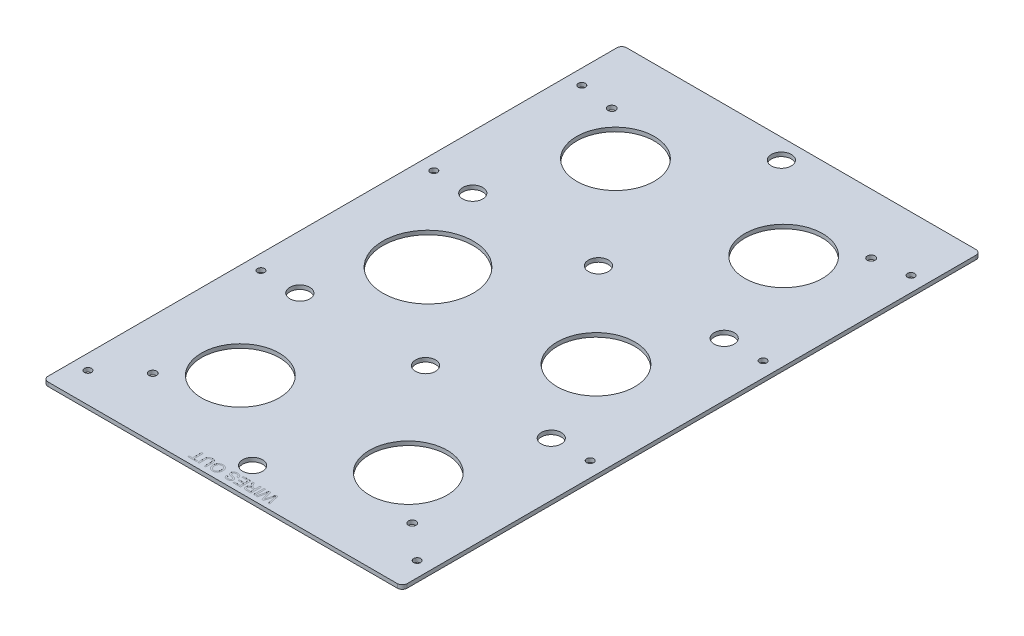
from build123d import *

# Parameters (mm, degrees)
SKETCH1_R           = 24.727
SKETCH1_R_2         = 28.76928198
SKETCH1_R_3         = 6.35
SKETCH1_R_4         = 2.45745
SKETCH1_R_5         = 2.2479
BOSS_EXTRUDE1_DEPTH = 2.54
SKETCH2_W           = 0.941716851
SKETCH2_H           = 6.677628581
CUT_EXTRUDE2_DEPTH  = 0.0254


with BuildPart() as part:
    # Sketch1 → Boss-Extrude1 (new body)
    with BuildSketch(Plane(origin=(0, 0, 0), x_dir=(1, 0, 0), z_dir=(0, 1, 0))):
        with BuildLine():
            Line((-56.121310553, 212.595268584), (166.128689447, 212.595268584))
            ThreePointArc((166.128689447, 212.595268584), (168.373753477, 211.665332614), (169.303689447, 209.420268584))
            Line((169.303689447, 209.420268584), (169.303689447, -152.529731416))
            ThreePointArc((169.303689447, -152.529731416), (168.373753477, -154.774795446), (166.128689447, -155.704731416))
            Line((166.128689447, -155.704731416), (-56.121310553, -155.704731416))
            ThreePointArc((-56.121310553, -155.704731416), (-58.366374583, -154.774795446), (-59.296310553, -152.529731416))
            Line((-59.296310553, -152.529731416), (-59.296310553, 209.420268584))
            ThreePointArc((-59.296310553, 209.420268584), (-58.366374583, 211.665332614), (-56.121310553, 212.595268584))
        make_face()
        with Locations((108.521489447, -91.0633131)):
            Circle(SKETCH1_R, mode=Mode.SUBTRACT)
        with Locations((108.521489447, 28.380977742)):
            Circle(SKETCH1_R, mode=Mode.SUBTRACT)
        with Locations((1.485889447, -90.934731416)):
            Circle(SKETCH1_R, mode=Mode.SUBTRACT)
        with Locations((1.485889447, 147.825268584)):
            Circle(SKETCH1_R, mode=Mode.SUBTRACT)
        with Locations((108.521489447, 147.825268584)):
            Circle(SKETCH1_R, mode=Mode.SUBTRACT)
        with Locations((1.485889447, 28.509559426)):
            Circle(SKETCH1_R_2, mode=Mode.SUBTRACT)
        with Locations((55.003689447, -136.654731416)):
            Circle(SKETCH1_R_3, mode=Mode.SUBTRACT)
        with Locations((135.013689447, -26.583831416)):
            Circle(SKETCH1_R_3, mode=Mode.SUBTRACT)
        with Locations((55.003689447, -26.588064749)):
            Circle(SKETCH1_R_3, mode=Mode.SUBTRACT)
        with Locations((-25.006310553, -26.583831416)):
            Circle(SKETCH1_R_3, mode=Mode.SUBTRACT)
        with Locations((135.013689447, 83.474368584)):
            Circle(SKETCH1_R_3, mode=Mode.SUBTRACT)
        with Locations((55.003689447, 83.478601917)):
            Circle(SKETCH1_R_3, mode=Mode.SUBTRACT)
        with Locations((-25.006310553, 83.474368584)):
            Circle(SKETCH1_R_3, mode=Mode.SUBTRACT)
        with Locations((55.003689447, 199.895268584)):
            Circle(SKETCH1_R_3, mode=Mode.SUBTRACT)
        with Locations((137.553689447, 174.495268584)):
            Circle(SKETCH1_R_4, mode=Mode.SUBTRACT)
        with Locations((-27.546310553, 174.495268584)):
            Circle(SKETCH1_R_4, mode=Mode.SUBTRACT)
        with Locations((-27.546310553, -117.604731416)):
            Circle(SKETCH1_R_4, mode=Mode.SUBTRACT)
        with Locations((137.553689447, -117.604731416)):
            Circle(SKETCH1_R_4, mode=Mode.SUBTRACT)
        with Locations((-49.771310553, 177.670268584)):
            Circle(SKETCH1_R_5, mode=Mode.SUBTRACT)
        with Locations((-49.771310553, 83.478601917)):
            Circle(SKETCH1_R_5, mode=Mode.SUBTRACT)
        with Locations((159.778689447, 177.670268584)):
            Circle(SKETCH1_R_5, mode=Mode.SUBTRACT)
        with Locations((159.778689447, 83.478601917)):
            Circle(SKETCH1_R_5, mode=Mode.SUBTRACT)
        with Locations((159.778689447, -26.588064749)):
            Circle(SKETCH1_R_5, mode=Mode.SUBTRACT)
        with Locations((-49.771310553, -26.588064749)):
            Circle(SKETCH1_R_5, mode=Mode.SUBTRACT)
        with Locations((-49.771310553, -136.654731416)):
            Circle(SKETCH1_R_5, mode=Mode.SUBTRACT)
        with Locations((159.778689447, -136.654731416)):
            Circle(SKETCH1_R_5, mode=Mode.SUBTRACT)
    extrude(amount=BOSS_EXTRUDE1_DEPTH)

    # Sketch2 → Cut-Extrude2 (cut)
    # profile 1 of 8: a face of its own
    with BuildSketch(Plane(origin=(0, 2.54, 0), x_dir=(1, 0, 0), z_dir=(0, 1, 0))):
        with BuildLine():
            Line((80.029279661, -145.704731416), (81.7107258, -152.382359997))
            Line((81.7107258, -152.382359997), (80.738242631, -152.382359997))
            Line((80.738242631, -152.382359997), (79.747032138, -147.990802579))
            add(Edge.make_bspline(
                [(79.747032138, -147.990802579), (79.695661446, -147.764312224), (79.593444513, -147.313643795), (79.492338116, -146.862724924), (79.442044295, -146.638422271)],
                knots=[0, 0, 0, 0, 1.00513078, 2, 2, 2, 2], degree=3))
            add(Edge.make_bspline(
                [(79.442044295, -146.638422271), (79.418231748, -146.719075954), (79.373278, -146.87133541), (79.312509244, -147.08717786), (79.25731493, -147.27555915), (79.210292208, -147.437357484), (79.172218091, -147.572800178), (79.139345331, -147.680222921), (79.116939668, -147.761729399), (79.103662032, -147.806664191), (79.098264137, -147.824931997)],
                knots=[0, 0, 0, 0, 1.633809233, 3.084334118, 4.356383392, 5.447555203, 6.357852567, 7.089694452, 7.629924063, 8, 8, 8, 8], degree=3))
            Line((79.098264137, -147.824931997), (77.779325479, -152.382359997))
            Line((77.779325479, -152.382359997), (76.646322393, -152.382359997))
            Line((76.646322393, -152.382359997), (75.692566548, -149.036857377))
            add(Edge.make_bspline(
                [(75.692566548, -149.036857377), (75.639932506, -148.830185346), (75.536149567, -148.422672829), (75.398257182, -147.81566784), (75.270986917, -147.223388915), (75.197676855, -146.831660892), (75.161513153, -146.638422271)],
                knots=[0, 0, 0, 0, 1.04154457, 2.053700482, 3.039894486, 4, 4, 4, 4], degree=3))
            add(Edge.make_bspline(
                [(75.161513153, -146.638422271), (75.139132616, -146.736944292), (75.091854028, -146.94507076), (75.019147923, -147.273539991), (74.936629564, -147.63395597), (74.880486071, -147.885100536), (74.851174645, -148.016218233)],
                knots=[0, 0, 0, 0, 0.858436457, 1.813435672, 2.858437265, 4, 4, 4, 4], degree=3))
            Line((74.851174645, -148.016218233), (73.865314817, -152.382359997))
            Line((73.865314817, -152.382359997), (72.892831648, -152.382359997))
            Line((72.892831648, -152.382359997), (74.575615453, -145.704731416))
            Line((74.575615453, -145.704731416), (75.610968923, -145.704731416))
            Line((75.610968923, -145.704731416), (77.006154542, -150.807927136))
            add(Edge.make_bspline(
                [(77.006154542, -150.807927136), (77.020164215, -150.857815617), (77.046777378, -150.952585154), (77.081661001, -151.087824496), (77.116254037, -151.206761932), (77.143769386, -151.310934535), (77.167581617, -151.399292569), (77.188668366, -151.471577335), (77.202230796, -151.529203562), (77.212038516, -151.561956596), (77.216168101, -151.57574741)],
                knots=[0, 0, 0, 0, 1.562239628, 2.967673567, 4.210417925, 5.296319877, 6.215971374, 6.969386481, 7.566055473, 8, 8, 8, 8], degree=3))
            add(Edge.make_bspline(
                [(77.216168101, -151.57574741), (77.240993719, -151.488311611), (77.288018835, -151.322689209), (77.356503208, -151.089823335), (77.415382597, -150.885483445), (77.452024197, -150.759319766), (77.468986972, -150.700913858)],
                knots=[0, 0, 0, 0, 1.197732026, 2.268764715, 3.198546125, 4, 4, 4, 4], degree=3))
            Line((77.468986972, -150.700913858), (78.915003898, -145.704731416))
            Line((78.915003898, -145.704731416), (80.029279661, -145.704731416))
        make_face()
    # profile 2 of 8: a face of its own
    with BuildSketch(Plane(origin=(0, 2.54, 0), x_dir=(1, 0, 0), z_dir=(0, 1, 0))):
        with Locations((71.737088239, -149.043545707)):
            Rectangle(SKETCH2_W, SKETCH2_H)
    # profile 3 of 8: a face of its own
    with BuildSketch(Plane(origin=(0, 2.54, 0), x_dir=(1, 0, 0), z_dir=(0, 1, 0))):
        with BuildLine():
            Line((69.725238603, -145.704731416), (69.725238603, -152.382359997))
            Line((69.725238603, -152.382359997), (66.827854087, -152.382359997))
            add(Edge.make_bspline(
                [(66.827854087, -152.382359997), (66.759629228, -152.381827962), (66.627588, -152.380798272), (66.436106253, -152.373440351), (66.25779954, -152.357808443), (66.091544097, -152.340349513), (65.937624411, -152.314571062), (65.795967128, -152.28432829), (65.667115536, -152.248584849), (65.550089215, -152.20633462), (65.441505485, -152.158550478), (65.340885212, -152.099559989), (65.243907957, -152.035030329), (65.154439449, -151.958586204), (65.068450058, -151.876455256), (64.989539904, -151.78452804), (64.915373648, -151.685105409), (64.825197278, -151.541131601), (64.730487537, -151.348144969), (64.648912432, -151.102957418), (64.597041436, -150.846216607), (64.591442148, -150.670841687), (64.588601234, -150.581861585)],
                knots=[0, 0, 0, 0, 1.242075696, 2.40389213, 3.487198984, 4.500157661, 5.446319301, 6.326791195, 7.136300648, 7.878370406, 8.590488565, 9.292260633, 9.999224673, 10.708050372, 11.431369221, 12.162165018, 12.910600795, 13.687589445, 15.252257874, 16.810406251, 18.381693487, 20, 20, 20, 20], degree=3))
            add(Edge.make_bspline(
                [(64.588601234, -150.581861585), (64.589907939, -150.524740088), (64.592488773, -150.411921213), (64.612257927, -150.246047086), (64.648029381, -150.087561728), (64.693896712, -149.935073876), (64.756684454, -149.790755988), (64.829388085, -149.651615869), (64.919584598, -149.521641487), (65.020293841, -149.396488972), (65.13740046, -149.281806219), (65.267662733, -149.175811763), (65.41499687, -149.084850699), (65.574570578, -149.000318383), (65.750496328, -148.930895346), (65.940120993, -148.869766111), (66.14491216, -148.822633746), (66.286855968, -148.798892657), (66.359670993, -148.786713838)],
                knots=[0, 0, 0, 0, 0.982645791, 1.940792824, 2.867691729, 3.775150443, 4.675643875, 5.571354211, 6.471357401, 7.392684514, 8.331098131, 9.285922955, 10.275520706, 11.304845665, 12.388884831, 13.524255008, 14.729980297, 16, 16, 16, 16], degree=3))
            add(Edge.make_bspline(
                [(66.359670993, -148.786713838), (66.305740634, -148.75983205), (66.203466532, -148.708853145), (66.064293374, -148.624504804), (65.942371498, -148.545098059), (65.873114839, -148.485554196), (65.840656592, -148.457648007)],
                knots=[0, 0, 0, 0, 1.172551213, 2.223638478, 3.167479604, 4, 4, 4, 4], degree=3))
            add(Edge.make_bspline(
                [(65.840656592, -148.457648007), (65.777468442, -148.395895573), (65.64787995, -148.2692515), (65.471039527, -148.051539052), (65.296058038, -147.81211767), (65.191002805, -147.6376469), (65.137044286, -147.548035139)],
                knots=[0, 0, 0, 0, 0.918170575, 1.883016652, 2.912673989, 4, 4, 4, 4], degree=3))
            Line((65.137044286, -147.548035139), (64.041495847, -145.704731416))
            Line((64.041495847, -145.704731416), (65.120992294, -145.704731416))
            Line((65.120992294, -145.704731416), (65.953020535, -147.114631361))
            add(Edge.make_bspline(
                [(65.953020535, -147.114631361), (65.982937923, -147.164098167), (66.040912909, -147.259956715), (66.12462569, -147.399973664), (66.206813768, -147.528808538), (66.282671411, -147.650471976), (66.357009397, -147.761755466), (66.423648427, -147.866870579), (66.490571396, -147.959862494), (66.567413815, -148.071581699), (66.661257567, -148.192370364), (66.770766589, -148.316455456), (66.871452849, -148.419242035), (66.998685638, -148.517314097), (67.156892938, -148.607108645), (67.290284254, -148.649704776), (67.354894484, -148.670336898)],
                knots=[0, 0, 0, 0, 1.130591283, 2.190900266, 3.190104209, 4.119071823, 4.994606968, 5.807262858, 6.55236009, 7.234593472, 8.459046683, 9.540234366, 10.471327768, 11.266723835, 12.676093724, 14, 14, 14, 14], degree=3))
            add(Edge.make_bspline(
                [(67.354894484, -148.670336898), (67.382037121, -148.675231638), (67.444004575, -148.686406476), (67.549225158, -148.69370478), (67.676712802, -148.701450954), (67.769105271, -148.701225256), (67.819064579, -148.701103215)],
                knots=[0, 0, 0, 0, 0.709978628, 1.620902492, 2.713552433, 4, 4, 4, 4], degree=3))
            Line((67.819064579, -148.701103215), (68.783521752, -148.701103215))
            Line((68.783521752, -148.701103215), (68.783521752, -145.704731416))
            Line((68.783521752, -145.704731416), (69.725238603, -145.704731416))
        make_face()
        with BuildLine():
            Line((68.783521752, -149.471598821), (66.995062335, -149.471598821))
            add(Edge.make_bspline(
                [(66.995062335, -149.471598821), (66.905378152, -149.472989815), (66.737721983, -149.47559015), (66.503340952, -149.498134703), (66.302851091, -149.533375071), (66.133691433, -149.586899254), (65.991529233, -149.658578696), (65.868316922, -149.746235717), (65.764716885, -149.854984869), (65.679514802, -149.97968191), (65.612910025, -150.115575815), (65.566369983, -150.259402832), (65.53512463, -150.408405004), (65.531929843, -150.510360449), (65.530318085, -150.561796596)],
                knots=[0, 0, 0, 0, 1.546056516, 2.890207646, 4.055830773, 5.050253158, 5.937355789, 6.790906573, 7.644595853, 8.512568064, 9.38593768, 10.244184789, 11.114197691, 12, 12, 12, 12], degree=3))
            add(Edge.make_bspline(
                [(65.530318085, -150.561796596), (65.531555421, -150.599281171), (65.533978998, -150.672702444), (65.546819416, -150.78042932), (65.571249426, -150.882517958), (65.604983943, -150.979704261), (65.647696765, -151.072199236), (65.700184065, -151.159639095), (65.762175013, -151.241577229), (65.833285898, -151.318417024), (65.91490542, -151.38834434), (66.008142078, -151.448673601), (66.112251337, -151.49994125), (66.227356803, -151.540630467), (66.353095126, -151.573175281), (66.490182326, -151.59482628), (66.637991409, -151.610492876), (66.740414535, -151.611398678), (66.793074771, -151.611864391)],
                knots=[0, 0, 0, 0, 0.965235723, 1.89061323, 2.787065514, 3.661873922, 4.534873316, 5.404925039, 6.281839248, 7.175200054, 8.095223355, 9.040740021, 10.02630299, 11.075573487, 12.177989335, 13.364883635, 14.645170704, 16, 16, 16, 16], degree=3))
            Line((66.793074771, -151.611864391), (68.783521752, -151.611864391))
            Line((68.783521752, -151.611864391), (68.783521752, -149.471598821))
        make_face(mode=Mode.SUBTRACT)
    # profile 4 of 8: a face of its own
    with BuildSketch(Plane(origin=(0, 2.54, 0), x_dir=(1, 0, 0), z_dir=(0, 1, 0))):
        Polygon((63.047610023, -145.704731416), (63.047610023, -152.382359997), (58.339025767, -152.382359997), (58.339025767, -151.611864391), (62.105893172, -151.611864391), (62.105893172, -149.557209443), (58.595857635, -149.557209443), (58.595857635, -148.786713838), (62.105893172, -148.786713838), (62.105893172, -146.475227022), (58.167804521, -146.475227022), (58.167804521, -145.704731416), align=None)
    # profile 5 of 8: a face of its own
    with BuildSketch(Plane(origin=(0, 2.54, 0), x_dir=(1, 0, 0), z_dir=(0, 1, 0))):
        with BuildLine():
            Line((57.22608767, -148.016218233), (56.284370819, -148.016218233))
            add(Edge.make_bspline(
                [(56.284370819, -148.016218233), (56.274036117, -147.931652183), (56.254182596, -147.769196247), (56.198230694, -147.539143921), (56.127744398, -147.331765305), (56.034997955, -147.147273237), (55.92108129, -146.981277245), (55.778553671, -146.834274944), (55.607402601, -146.705232553), (55.411663162, -146.594893332), (55.197484631, -146.5019483), (54.966757588, -146.436745749), (54.722897055, -146.39720687), (54.55581207, -146.392182119), (54.470495748, -146.389616399)],
                knots=[0, 0, 0, 0, 1.125761249, 2.162647979, 3.12492346, 4.01623828, 4.884793378, 5.777219259, 6.711258599, 7.709587174, 8.742442187, 9.791331093, 10.872217593, 12, 12, 12, 12], degree=3))
            add(Edge.make_bspline(
                [(54.470495748, -146.389616399), (54.395012142, -146.391020079), (54.248275368, -146.39374877), (54.035161199, -146.426314589), (53.835192167, -146.474492858), (53.650528629, -146.543784278), (53.484881741, -146.630884243), (53.337848957, -146.730338577), (53.21590082, -146.848862493), (53.117256921, -146.97986137), (53.040703733, -147.118970535), (52.987333539, -147.262482959), (52.951401229, -147.407604013), (52.947495522, -147.505916251), (52.945556529, -147.554723469)],
                knots=[0, 0, 0, 0, 1.267544124, 2.464049433, 3.614542348, 4.719673496, 5.768837234, 6.754183997, 7.692231426, 8.612479311, 9.501217876, 10.350240008, 11.180974857, 12, 12, 12, 12], degree=3))
            add(Edge.make_bspline(
                [(52.945556529, -147.554723469), (52.947602205, -147.603051819), (52.951604584, -147.697606546), (52.983354602, -147.83448118), (53.034659483, -147.961839203), (53.106627636, -148.080767085), (53.204438753, -148.190545656), (53.330920283, -148.287996323), (53.482548856, -148.38068759), (53.596709803, -148.430119962), (53.657194831, -148.456310341)],
                knots=[0, 0, 0, 0, 0.942081658, 1.843188798, 2.725198023, 3.611401405, 4.541884661, 5.575766242, 6.715586633, 8, 8, 8, 8], degree=3))
            add(Edge.make_bspline(
                [(53.657194831, -148.456310341), (53.680720403, -148.465964594), (53.733868945, -148.487775307), (53.824963937, -148.516645948), (53.933055061, -148.553995036), (54.060353956, -148.592260466), (54.206992519, -148.633260146), (54.371625653, -148.680444223), (54.555559453, -148.729579011), (54.752352418, -148.781595403), (54.951550784, -148.834355039), (55.141834246, -148.888300752), (55.317983836, -148.939465805), (55.479329045, -148.99205191), (55.626024384, -149.043952649), (55.758470628, -149.094832643), (55.876903383, -149.143425756), (55.949235832, -149.179162423), (55.983395973, -149.196039628)],
                knots=[0, 0, 0, 0, 0.499208779, 1.12780332, 1.87546358, 2.745246929, 3.737578632, 4.865834649, 6.108484299, 7.476352792, 8.863398792, 10.155242256, 11.360521946, 12.465428895, 13.487415091, 14.415997097, 15.251929613, 16, 16, 16, 16], degree=3))
            add(Edge.make_bspline(
                [(55.983395973, -149.196039628), (56.061939332, -149.238549093), (56.213548457, -149.320603422), (56.418387849, -149.466445689), (56.588087262, -149.631435602), (56.728032509, -149.809204512), (56.836079416, -150.000673688), (56.912416665, -150.203746025), (56.96199253, -150.417629242), (56.96680774, -150.56464044), (56.969255802, -150.639381223)],
                knots=[0, 0, 0, 0, 1.158956011, 2.237086722, 3.252429106, 4.221720014, 5.165272549, 6.094237939, 7.031106807, 8, 8, 8, 8], degree=3))
            add(Edge.make_bspline(
                [(56.969255802, -150.639381223), (56.966081922, -150.722169384), (56.959769099, -150.886834437), (56.903631, -151.128422791), (56.814219476, -151.361652776), (56.711224913, -151.546243423), (56.612252857, -151.686400222), (56.529071871, -151.785780629), (56.437284812, -151.878203422), (56.33889894, -151.965586195), (56.230361925, -152.044661593), (56.114924838, -152.118074619), (55.990222979, -152.183860466), (55.81367115, -152.264065642), (55.578842787, -152.346297072), (55.283173868, -152.417541618), (54.971970371, -152.459247391), (54.759556851, -152.465021748), (54.651080655, -152.46797062)],
                knots=[0, 0, 0, 0, 1.200056028, 2.386902731, 3.579012093, 4.815906327, 5.442508847, 6.067203999, 6.694073756, 7.331409728, 7.974631341, 8.640655778, 9.315145047, 10.018831381, 11.453504181, 12.917815188, 14.425977399, 16, 16, 16, 16], degree=3))
            add(Edge.make_bspline(
                [(54.651080655, -152.46797062), (54.532328079, -152.465335452), (54.301536136, -152.460214087), (53.965948585, -152.415048168), (53.652011121, -152.342269778), (53.406259629, -152.256526219), (53.224097329, -152.171298161), (53.09569649, -152.102618852), (52.976105466, -152.025216619), (52.863042146, -151.943262026), (52.760547182, -151.851416675), (52.664387424, -151.75451086), (52.576180596, -151.650676539), (52.471432464, -151.502375157), (52.360787582, -151.304042733), (52.26086547, -151.049659933), (52.196879074, -150.779183734), (52.182410966, -150.5933387), (52.175060923, -150.498926295)],
                knots=[0, 0, 0, 0, 1.607451709, 3.124032445, 4.575401297, 5.965664223, 6.638286369, 7.297495781, 7.935629741, 8.566004073, 9.186263309, 9.796807256, 10.413736732, 11.028594479, 12.253110936, 13.478624344, 14.719098735, 16, 16, 16, 16], degree=3))
            Line((52.175060923, -150.498926295), (53.116777774, -150.498926295))
            add(Edge.make_bspline(
                [(53.116777774, -150.498926295), (53.12256482, -150.546790135), (53.1339, -150.640541808), (53.165699429, -150.775279325), (53.203736155, -150.901835006), (53.252104235, -151.018786484), (53.309830176, -151.127167922), (53.37830271, -151.225743174), (53.454811782, -151.316377881), (53.541203273, -151.397481453), (53.638294539, -151.46870712), (53.746105914, -151.530263898), (53.864237666, -151.582876538), (53.993835671, -151.623436732), (54.133167052, -151.657118748), (54.283834793, -151.681296537), (54.445312172, -151.693821225), (54.556533166, -151.696235632), (54.613626008, -151.697475014)],
                knots=[0, 0, 0, 0, 1.074256797, 2.104164074, 3.082231143, 4.018364317, 4.921387537, 5.814946689, 6.689553043, 7.561782592, 8.450683137, 9.368204304, 10.325224224, 11.328240899, 12.391723181, 13.519579538, 14.726730929, 16, 16, 16, 16], degree=3))
            add(Edge.make_bspline(
                [(54.613626008, -151.697475014), (54.672972195, -151.697033587), (54.787851817, -151.696179094), (54.95388876, -151.680315804), (55.107908151, -151.658931698), (55.248960533, -151.626106316), (55.378362134, -151.587486496), (55.493843198, -151.535627275), (55.598156125, -151.477168085), (55.689398524, -151.408644046), (55.768042412, -151.332675231), (55.838626331, -151.254638279), (55.895538928, -151.17045065), (55.9456534, -151.084774031), (55.980571056, -150.99305167), (56.007980626, -150.899274119), (56.024647148, -150.801380567), (56.026561696, -150.734865537), (56.027538951, -150.700913858)],
                knots=[0, 0, 0, 0, 1.464224776, 2.834379057, 4.11387117, 5.299348816, 6.406355048, 7.441191667, 8.417293255, 9.352838038, 10.248153785, 11.113750317, 11.944205591, 12.75240885, 13.557683963, 14.358962649, 15.162355132, 16, 16, 16, 16], degree=3))
            add(Edge.make_bspline(
                [(56.027538951, -150.700913858), (56.025105333, -150.643462477), (56.020381904, -150.531954643), (55.972148797, -150.373535625), (55.89796594, -150.229126425), (55.824884006, -150.150554117), (55.78809674, -150.11100316)],
                knots=[0, 0, 0, 0, 1.050964922, 2.039826012, 3.013306874, 4, 4, 4, 4], degree=3))
            add(Edge.make_bspline(
                [(55.78809674, -150.11100316), (55.764906441, -150.091237481), (55.713622525, -150.047526901), (55.618200873, -149.989681153), (55.499892293, -149.931234951), (55.357905621, -149.873137007), (55.192488119, -149.814670252), (55.003893205, -149.754515149), (54.791046034, -149.694461366), (54.56099498, -149.637528445), (54.328914973, -149.579071519), (54.108668391, -149.52147128), (53.905664624, -149.467642831), (53.722241075, -149.41160268), (53.555379549, -149.362447621), (53.408387696, -149.31054747), (53.278624712, -149.263448691), (53.199158703, -149.230204154), (53.162258418, -149.214766952)],
                knots=[0, 0, 0, 0, 0.523895407, 1.158562347, 1.913798076, 2.79478753, 3.797549825, 4.933675542, 6.202127117, 7.604032848, 9.013379355, 10.32225155, 11.523321485, 12.628397413, 13.623935419, 14.51727859, 15.311493772, 16, 16, 16, 16], degree=3))
            add(Edge.make_bspline(
                [(53.162258418, -149.214766952), (53.114237299, -149.192642663), (53.019979891, -149.14921639), (52.886607207, -149.074857982), (52.761347407, -148.998303761), (52.648100997, -148.913945073), (52.541303271, -148.829473553), (52.446401397, -148.738152653), (52.361353982, -148.64213119), (52.260611548, -148.510201197), (52.157272926, -148.332129366), (52.068486422, -148.101983909), (52.012948169, -147.856092742), (52.006913414, -147.68655586), (52.003839678, -147.600204112)],
                knots=[0, 0, 0, 0, 0.899363591, 1.76530001, 2.59691609, 3.395188894, 4.166615117, 4.912545108, 5.632755751, 6.347510175, 7.734752518, 9.118421309, 10.532299558, 12, 12, 12, 12], degree=3))
            add(Edge.make_bspline(
                [(52.003839678, -147.600204112), (52.007379693, -147.512947481), (52.014425473, -147.339278427), (52.073306705, -147.083670735), (52.167783661, -146.836498404), (52.277131577, -146.640406238), (52.380908177, -146.490405381), (52.46805695, -146.382582695), (52.564707583, -146.282886624), (52.66847164, -146.188190253), (52.780157577, -146.100428246), (52.90070475, -146.019563988), (53.028847063, -145.944780918), (53.211805644, -145.853551254), (53.455094931, -145.758813104), (53.764044377, -145.676641079), (54.090829604, -145.627950211), (54.314714943, -145.622105191), (54.429028102, -145.619120793)],
                knots=[0, 0, 0, 0, 1.196987384, 2.382393894, 3.582009067, 4.820735309, 5.454243406, 6.085350439, 6.72189866, 7.359035515, 8.013098289, 8.67027723, 9.350744424, 10.048966745, 11.475869723, 12.9268444, 14.430883741, 16, 16, 16, 16], degree=3))
            add(Edge.make_bspline(
                [(54.429028102, -145.619120793), (54.501724447, -145.619797777), (54.644571207, -145.621128036), (54.854009777, -145.63431666), (55.054143614, -145.658144771), (55.245773398, -145.685725106), (55.427995129, -145.727177668), (55.601854388, -145.773949607), (55.765765293, -145.832626587), (55.921532804, -145.897184112), (56.067730879, -145.973465379), (56.207429169, -146.055221012), (56.337247096, -146.149004708), (56.461030966, -146.248461662), (56.575045939, -146.359105701), (56.680611206, -146.478354849), (56.77887416, -146.605938118), (56.868092721, -146.741993436), (56.947740021, -146.884960745), (57.019442486, -147.03235512), (57.07944818, -147.184962788), (57.128897857, -147.342424979), (57.169375954, -147.504026887), (57.19823807, -147.670844972), (57.219190157, -147.841832706), (57.223774919, -147.957746378), (57.22608767, -148.016218233)],
                knots=[0, 0, 0, 0, 1.259929758, 2.475735005, 3.634725603, 4.752877801, 5.82919746, 6.871690464, 7.871395985, 8.84458164, 9.791640072, 10.727373556, 11.647336026, 12.564665335, 13.477425593, 14.397128332, 15.323044476, 16.266184727, 17.214251675, 18.157898412, 19.105082968, 20.053433368, 21.01687335, 21.990151059, 22.98614553, 24, 24, 24, 24], degree=3))
        make_face()
    # profile 6 of 8: a face of its own
    with BuildSketch(Plane(origin=(0, 2.54, 0), x_dir=(1, 0, 0), z_dir=(0, 1, 0))):
        with BuildLine():
            add(Edge.make_bspline(
                [(48.493804142, -148.955259752), (48.491467599, -149.089135529), (48.486914966, -149.349985692), (48.444878562, -149.729899077), (48.375530549, -150.086921252), (48.280135178, -150.422703732), (48.153256187, -150.734714085), (48.002707821, -151.026789018), (47.820043627, -151.293844928), (47.613644944, -151.538969607), (47.383043857, -151.755657917), (47.137535236, -151.948113422), (46.874034222, -152.108642761), (46.59498038, -152.241187416), (46.299186796, -152.342951276), (45.987484329, -152.414195261), (45.660206242, -152.460154548), (45.436504015, -152.465327419), (45.322198099, -152.46797062)],
                knots=[0, 0, 0, 0, 1.203593535, 2.345140965, 3.431924157, 4.471254512, 5.478692091, 6.45615896, 7.42038538, 8.382007041, 9.33218277, 10.260966195, 11.182476517, 12.100814648, 13.034113903, 13.98924309, 14.972556454, 16, 16, 16, 16], degree=3))
            add(Edge.make_bspline(
                [(45.322198099, -152.46797062), (45.246803118, -152.466666047), (45.097082322, -152.464075401), (44.875336318, -152.443970034), (44.659554943, -152.409061507), (44.449611732, -152.360498158), (44.245197005, -152.299400427), (44.04644571, -152.223941082), (43.853040257, -152.135665273), (43.666712333, -152.033067288), (43.488785231, -151.917618035), (43.319985167, -151.79251744), (43.162934584, -151.655256349), (43.016875567, -151.507656459), (42.880679081, -151.349793667), (42.758697678, -151.178719662), (42.643711434, -150.999837338), (42.542898006, -150.809040243), (42.451508274, -150.610712696), (42.374904164, -150.403995115), (42.307064707, -150.191850055), (42.252288146, -149.972959882), (42.211457264, -149.746700078), (42.180059978, -149.514696505), (42.163106161, -149.275659739), (42.160126709, -149.114465609), (42.158618052, -149.032844379)],
                knots=[0, 0, 0, 0, 1.034176269, 2.053687022, 3.051235935, 4.030520976, 5.007759882, 5.975670013, 6.944584641, 7.921900115, 8.890679583, 9.85222947, 10.801660264, 11.7488817, 12.698942795, 13.658174729, 14.62880618, 15.613957309, 16.61577279, 17.622338666, 18.636016077, 19.670029534, 20.714984856, 21.788550191, 22.880224384, 24, 24, 24, 24], degree=3))
            add(Edge.make_bspline(
                [(42.158618052, -149.032844379), (42.160009382, -148.949878825), (42.162758195, -148.785966068), (42.181357784, -148.543816775), (42.214062327, -148.308619086), (42.257439336, -148.079671684), (42.315563203, -147.85745119), (42.384634487, -147.641320483), (42.468180105, -147.432566885), (42.562535617, -147.230687242), (42.669298792, -147.038458153), (42.787065988, -146.857223581), (42.915919864, -146.688679534), (43.053905959, -146.530755832), (43.203783041, -146.38672136), (43.364393449, -146.254432261), (43.535408741, -146.13445772), (43.716158567, -146.026090066), (43.903755164, -145.93080257), (44.095920731, -145.846594873), (44.292881899, -145.778463632), (44.49175709, -145.718034174), (44.695507697, -145.674582309), (44.90221245, -145.642203665), (45.113170034, -145.623270241), (45.254832495, -145.62051105), (45.326211097, -145.619120793)],
                knots=[0, 0, 0, 0, 1.141458971, 2.255149016, 3.338763392, 4.407145747, 5.45911027, 6.497028761, 7.526847988, 8.550472592, 9.561035647, 10.549629976, 11.521388012, 12.477647518, 13.432134385, 14.377847498, 15.337760086, 16.303574593, 17.274809663, 18.230970776, 19.187525402, 20.140611526, 21.088808525, 22.051011914, 23.017975238, 24, 24, 24, 24], degree=3))
            add(Edge.make_bspline(
                [(45.326211097, -145.619120793), (45.402948895, -145.620309681), (45.554947256, -145.62266457), (45.779842351, -145.644345492), (45.998398809, -145.681460676), (46.211866877, -145.728050436), (46.41787104, -145.793461052), (46.618134934, -145.870530878), (46.811173889, -145.963796859), (46.997979616, -146.069154763), (47.176878716, -146.185959466), (47.344078236, -146.315335396), (47.502045211, -146.452739616), (47.645968618, -146.603499345), (47.780158847, -146.762898302), (47.90416524, -146.932319795), (48.016235608, -147.112612503), (48.115748903, -147.302812003), (48.20548349, -147.498091438), (48.281127756, -147.698348896), (48.347593196, -147.900677047), (48.40052896, -148.10631126), (48.442711581, -148.314780295), (48.471076513, -148.525736434), (48.491561832, -148.739494085), (48.493052944, -148.882975927), (48.493804142, -148.955259752)],
                knots=[0, 0, 0, 0, 1.072846099, 2.125039441, 3.155166917, 4.171599398, 5.177324298, 6.174217088, 7.169783185, 8.172042761, 9.17156421, 10.154239632, 11.126115549, 12.096189878, 13.065322046, 14.038037562, 15.029377678, 16.03062832, 17.03785952, 18.032507603, 19.022297599, 20.014323703, 20.999862951, 21.994471951, 22.989647507, 24, 24, 24, 24], degree=3))
        make_face()
        with BuildLine():
            add(Edge.make_bspline(
                [(47.55208729, -148.944558424), (47.550644971, -148.848151817), (47.547832551, -148.660165739), (47.515627371, -148.386099128), (47.466818619, -148.12747685), (47.399344029, -147.883694112), (47.309257222, -147.656543018), (47.199115485, -147.445587371), (47.069916503, -147.249830078), (46.921728259, -147.071489589), (46.758902041, -146.911226752), (46.584902849, -146.77118446), (46.399892329, -146.654408047), (46.206319995, -146.556869438), (46.001619325, -146.481716297), (45.786771033, -146.428589759), (45.561779333, -146.395428666), (45.408370792, -146.391577959), (45.330224095, -146.389616399)],
                knots=[0, 0, 0, 0, 1.215616022, 2.370365452, 3.475740397, 4.533490648, 5.5560781, 6.552384115, 7.530550651, 8.509299237, 9.471863928, 10.40830403, 11.321168121, 12.226759389, 13.137923578, 14.065605683, 15.014614662, 16, 16, 16, 16], degree=3))
            add(Edge.make_bspline(
                [(45.330224095, -146.389616399), (45.250752104, -146.391605556), (45.095146171, -146.395500319), (44.866772386, -146.428101993), (44.649791707, -146.483604945), (44.442053557, -146.557491975), (44.247313311, -146.657374543), (44.061017796, -146.774336845), (43.888240741, -146.917260032), (43.724759335, -147.077811023), (43.578072709, -147.260286231), (43.448128555, -147.460286468), (43.341842815, -147.680297116), (43.253181458, -147.917154096), (43.183633952, -148.172343821), (43.135013735, -148.445864052), (43.105030043, -148.736993788), (43.101927623, -148.936903238), (43.100334903, -149.039532709)],
                knots=[0, 0, 0, 0, 0.976909331, 1.912785716, 2.828990727, 3.727421029, 4.617481149, 5.514840137, 6.426786422, 7.368873452, 8.327895072, 9.299698503, 10.295216142, 11.325792517, 12.405818789, 13.542541501, 14.738390493, 16, 16, 16, 16], degree=3))
            add(Edge.make_bspline(
                [(43.100334903, -149.039532709), (43.100903486, -149.105554772), (43.102018841, -149.235066167), (43.116789884, -149.425967441), (43.135842608, -149.610930612), (43.164850778, -149.789716918), (43.204827366, -149.961586304), (43.249115828, -150.127845986), (43.304492564, -150.287067658), (43.367340871, -150.43985966), (43.437610453, -150.58549569), (43.517069671, -150.722538432), (43.604030552, -150.8514426), (43.699393953, -150.971632766), (43.800749059, -151.084806113), (43.911322382, -151.188020439), (44.029292399, -151.283329151), (44.15467387, -151.369757222), (44.285454646, -151.447449459), (44.420970996, -151.514452815), (44.560791255, -151.571258814), (44.704771667, -151.615771008), (44.852045916, -151.652520297), (45.002969159, -151.679741754), (45.158723979, -151.694013149), (45.263761115, -151.696312772), (45.316847435, -151.697475014)],
                knots=[0, 0, 0, 0, 1.220320263, 2.393826742, 3.538159925, 4.657606474, 5.739544833, 6.799495376, 7.837090465, 8.853610905, 9.852768056, 10.824163015, 11.779900663, 12.724912201, 13.658747054, 14.586045767, 15.518168864, 16.460299482, 17.399069918, 18.328125852, 19.252745725, 20.186143833, 21.111865538, 22.057883325, 23.018444021, 24, 24, 24, 24], degree=3))
            add(Edge.make_bspline(
                [(45.316847435, -151.697475014), (45.391875075, -151.695959775), (45.54035477, -151.692961117), (45.758313263, -151.660557085), (45.968680565, -151.611773411), (46.169989069, -151.541307864), (46.36453317, -151.452843413), (46.550074066, -151.342701808), (46.727792545, -151.21319321), (46.896933348, -151.064868688), (47.054578213, -150.893751276), (47.187925289, -150.692139307), (47.300292819, -150.464699542), (47.394123674, -150.212050312), (47.465665272, -149.93222286), (47.515109926, -149.626424994), (47.546328144, -149.294333415), (47.550118497, -149.064130757), (47.55208729, -148.944558424)],
                knots=[0, 0, 0, 0, 0.895098135, 1.771399171, 2.624879489, 3.470001555, 4.31324378, 5.172350046, 6.041214072, 6.935108351, 7.854676913, 8.809932058, 9.809814619, 10.877726151, 12.02168834, 13.252153056, 14.572707754, 16, 16, 16, 16], degree=3))
        make_face(mode=Mode.SUBTRACT)
    # profile 7 of 8: a face of its own
    with BuildSketch(Plane(origin=(0, 2.54, 0), x_dir=(1, 0, 0), z_dir=(0, 1, 0))):
        with BuildLine():
            Line((36.765148814, -152.382359997), (35.823431963, -152.382359997))
            Line((35.823431963, -152.382359997), (35.823431963, -148.540583297))
            add(Edge.make_bspline(
                [(35.823431963, -148.540583297), (35.824411412, -148.45897922), (35.826317422, -148.300177551), (35.835036489, -148.068576242), (35.852184402, -147.849869969), (35.877863075, -147.644731811), (35.908551601, -147.451891603), (35.944806741, -147.272000632), (35.991007316, -147.105219306), (36.04286506, -146.949716853), (36.104617166, -146.804123123), (36.177639877, -146.666349763), (36.261564923, -146.535531599), (36.357338455, -146.411956559), (36.46343833, -146.29487412), (36.58111315, -146.185210389), (36.710891012, -146.083724093), (36.849481398, -145.986578671), (37.000533983, -145.899700665), (37.163716279, -145.824763303), (37.337981243, -145.760305959), (37.524177401, -145.708486233), (37.72145024, -145.668884286), (37.929514033, -145.639272061), (38.148883297, -145.621768164), (38.298973885, -145.620016319), (38.375698656, -145.619120793)],
                knots=[0, 0, 0, 0, 1.311377147, 2.551942077, 3.723550895, 4.835332178, 5.873100029, 6.860965504, 7.782222652, 8.65229484, 9.493385443, 10.320318369, 11.155067733, 11.987723446, 12.829729107, 13.691560723, 14.568860379, 15.475173283, 16.409214366, 17.364531151, 18.357450607, 19.391849073, 20.466818896, 21.588529868, 22.767281177, 24, 24, 24, 24], degree=3))
            add(Edge.make_bspline(
                [(38.375698656, -145.619120793), (38.450629239, -145.620223431), (38.596625633, -145.622371835), (38.810568722, -145.63690841), (39.014082344, -145.662643957), (39.207749865, -145.696498272), (39.390617457, -145.741994513), (39.562466619, -145.798599924), (39.724417206, -145.863888639), (39.876665989, -145.938431495), (40.016940359, -146.025159239), (40.148854482, -146.117782697), (40.268506084, -146.222155702), (40.378198887, -146.334346179), (40.478096698, -146.455276232), (40.566242152, -146.586099147), (40.646051113, -146.724938713), (40.712291373, -146.875383033), (40.772095602, -147.035955846), (40.822216924, -147.21003356), (40.865014212, -147.397616374), (40.899056, -147.599137402), (40.927944449, -147.814518169), (40.945146122, -148.044543636), (40.958072597, -148.288063667), (40.959392234, -148.454953209), (40.960069333, -148.540583297)],
                knots=[0, 0, 0, 0, 1.193078897, 2.324621146, 3.412165798, 4.458033356, 5.453301711, 6.409727336, 7.336550967, 8.231923267, 9.10494906, 9.959977801, 10.795507141, 11.62892236, 12.456145611, 13.289107106, 14.138012467, 15.002334476, 15.903094886, 16.864671381, 17.884255983, 18.965082669, 20.117808422, 21.342986352, 22.636701193, 24, 24, 24, 24], degree=3))
            Line((40.960069333, -148.540583297), (40.960069333, -152.382359997))
            Line((40.960069333, -152.382359997), (40.018352481, -152.382359997))
            Line((40.018352481, -152.382359997), (40.018352481, -148.584726275))
            add(Edge.make_bspline(
                [(40.018352481, -148.584726275), (40.017736434, -148.515610273), (40.01654776, -148.382249929), (40.010362879, -148.189060798), (39.997942115, -148.009788524), (39.982777145, -147.844572253), (39.961455997, -147.693653433), (39.934654207, -147.55712261), (39.904365764, -147.434189182), (39.859203509, -147.290303673), (39.783136467, -147.130314323), (39.667922462, -146.957600506), (39.520222528, -146.81256749), (39.349091393, -146.689554724), (39.153532921, -146.593613773), (38.936990082, -146.523776523), (38.699684913, -146.481955602), (38.534608724, -146.477520045), (38.449270285, -146.475227022)],
                knots=[0, 0, 0, 0, 1.090438201, 2.104016592, 3.048763244, 3.925116223, 4.720979001, 5.45216101, 6.119252661, 6.717681473, 7.82855347, 8.901677854, 9.976092604, 11.075141713, 12.213970494, 13.397440122, 14.654570346, 16, 16, 16, 16], degree=3))
            add(Edge.make_bspline(
                [(38.449270285, -146.475227022), (38.376105998, -146.476471385), (38.234833164, -146.478874124), (38.031126537, -146.49828557), (37.8443592, -146.533590543), (37.672656502, -146.579444162), (37.517403502, -146.640928643), (37.377485163, -146.715387077), (37.256601986, -146.80688453), (37.147224682, -146.909593678), (37.05486022, -147.034626717), (36.977676648, -147.183214985), (36.911112399, -147.355481131), (36.856601992, -147.553062546), (36.816794089, -147.776197948), (36.785695273, -148.023492495), (36.769383832, -148.29602024), (36.766601124, -148.485720593), (36.765148814, -148.584726275)],
                knots=[0, 0, 0, 0, 1.111591514, 2.146370713, 3.104407205, 3.996889121, 4.842307775, 5.6365848, 6.396727704, 7.139400744, 7.909024799, 8.745519786, 9.676513234, 10.710427131, 11.854494362, 13.117490512, 14.495602074, 16, 16, 16, 16], degree=3))
            Line((36.765148814, -148.584726275), (36.765148814, -152.382359997))
        make_face()
    # profile 8 of 8: a face of its own
    with BuildSketch(Plane(origin=(0, 2.54, 0), x_dir=(1, 0, 0), z_dir=(0, 1, 0))):
        Polygon((32.655838918, -145.704731416), (32.655838918, -151.611864391), (34.796104489, -151.611864391), (34.796104489, -152.382359997), (29.573856496, -152.382359997), (29.573856496, -151.611864391), (31.714122067, -151.611864391), (31.714122067, -145.704731416), align=None)
    extrude(amount=-CUT_EXTRUDE2_DEPTH, mode=Mode.SUBTRACT)


solid = part.part
